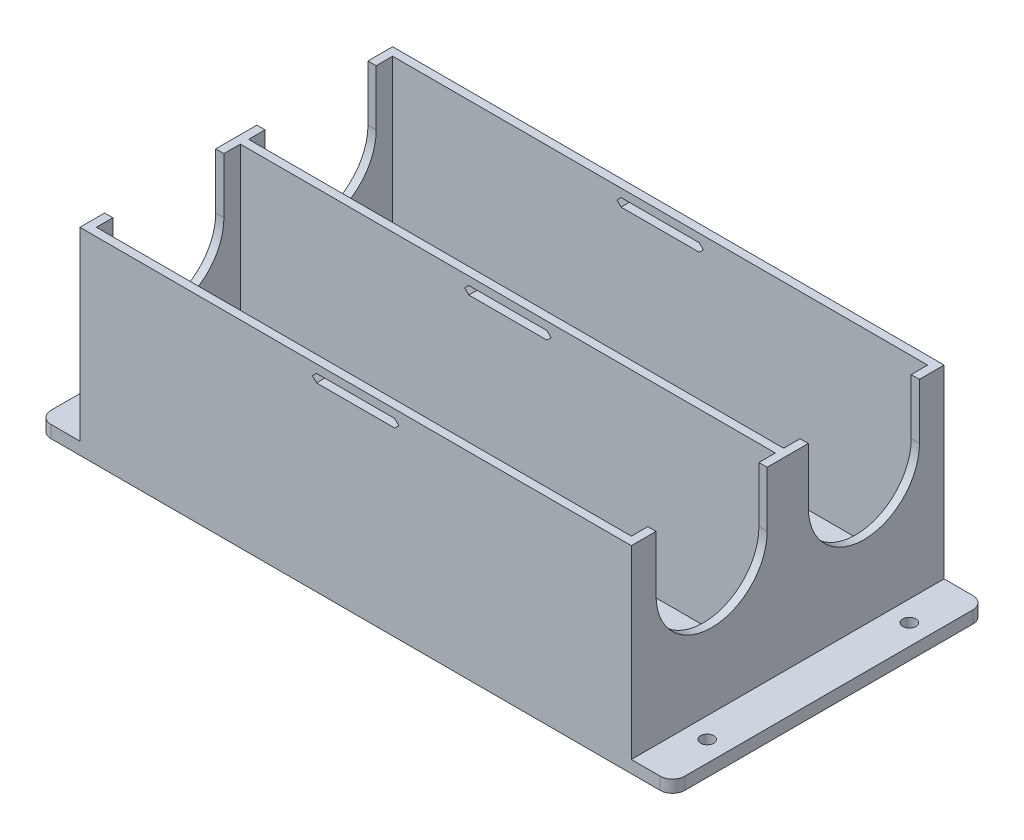
from build123d import *

# Parameters (mm, degrees)
SZKIC1_W                    = 154
SZKIC1_H                    = 76
DODANIE_WYCI_GNI_CIE1_DEPTH = 3
SZKIC1_3_W                  = 134
SZKIC1_3_H                  = 76
SZKIC1_3_W_2                = 130
SZKIC1_3_H_2                = 72
SZKIC1_3_H_3                = 2
DODANIE_WYCI_GNI_CIE2_DEPTH = 48
WYTNIJ_WYCI_GNI_CIE1_DEPTH  = 157.473639953
M3_CLEARANCE_HOLE1_D        = 3.2
M3_CLEARANCE_HOLE1_DEPTH    = 7.7
M3_CLEARANCE_HOLE1_TIP      = 0.96137699
ZAOKR_GLENIE1_R             = 3
SZKIC6_W                    = 21
SZKIC6_H                    = 2
WYTNIJ_WYCI_GNI_CIE2_DEPTH  = 119.359621493
SFAZOWANIE1_SIZE            = 1


with BuildPart() as part:
    # Szkic1 → Dodanie-wyciągnięcie1 (new body)
    with BuildSketch(Plane(origin=(0, 0, 0), x_dir=(1, 0, 0), z_dir=(0, 1, 0))):
        Rectangle(SZKIC1_W, SZKIC1_H)
    extrude(amount=DODANIE_WYCI_GNI_CIE1_DEPTH)

    # Szkic1<3> → Dodanie-wyciągnięcie2 (add)
    # profile 1 of 2: a face of its own
    with BuildSketch(Plane(origin=(0, 0, 0), x_dir=(1, 0, 0), z_dir=(0, 1, 0))):
        Rectangle(SZKIC1_3_W, SZKIC1_3_H)
        Rectangle(SZKIC1_3_W_2, SZKIC1_3_H_2, mode=Mode.SUBTRACT)
    # profile 2 of 2: a face of its own
    with BuildSketch(Plane(origin=(0, 0, 0), x_dir=(1, 0, 0), z_dir=(0, 1, 0))):
        Rectangle(SZKIC1_3_W_2, SZKIC1_3_H_3)
    extrude(amount=DODANIE_WYCI_GNI_CIE2_DEPTH)

    # Szkic2 → Wytnij-wyciągnięcie1 (cut, through all)
    with BuildSketch(Plane.ZY.offset(67)):
        with BuildLine():
            ThreePointArc((-5, 34.5), (-8.954058454, 44.045941546), (-18.5, 48))
            ThreePointArc((-18.5, 48), (-28.045941546, 44.045941546), (-32, 34.5))
            Line((-32, 34.5), (-5, 34.5))
        make_face()
        with BuildLine():
            Line((-5, 34.5), (-32, 34.5))
            ThreePointArc((-32, 34.5), (-18.5, 21), (-5, 34.5))
        make_face()
        with BuildLine():
            Line((-18.5, 48), (-32, 48))
            Line((-32, 48), (-32, 34.5))
            ThreePointArc((-32, 34.5), (-28.045941546, 44.045941546), (-18.5, 48))
        make_face()
        with BuildLine():
            Line((-5, 48), (-18.5, 48))
            ThreePointArc((-18.5, 48), (-8.954058454, 44.045941546), (-5, 34.5))
            Line((-5, 34.5), (-5, 48))
        make_face()
        with BuildLine():
            ThreePointArc((18.5, 48), (8.954058454, 44.045941546), (5, 34.5))
            Line((5, 34.5), (32, 34.5))
            ThreePointArc((32, 34.5), (28.045941546, 44.045941546), (18.5, 48))
        make_face()
        with BuildLine():
            Line((32, 34.5), (5, 34.5))
            ThreePointArc((5, 34.5), (18.5, 21), (32, 34.5))
        make_face()
        with BuildLine():
            Line((18.5, 48), (5, 48))
            Line((5, 48), (5, 34.5))
            ThreePointArc((5, 34.5), (8.954058454, 44.045941546), (18.5, 48))
        make_face()
        with BuildLine():
            Line((32, 48), (18.5, 48))
            ThreePointArc((18.5, 48), (28.045941546, 44.045941546), (32, 34.5))
            Line((32, 34.5), (32, 48))
        make_face()
    extrude(amount=-WYTNIJ_WYCI_GNI_CIE1_DEPTH, mode=Mode.SUBTRACT)

    # M3 Clearance Hole1
    with Locations(Plane(origin=(0, 3, 0), x_dir=(1, 0, 0), z_dir=(0, 1, 0))):
        with Locations((-72, 24.565309611), (-72, -24.565309611), (72, -24.565309611), (72, 24.565309611)):
            Hole(M3_CLEARANCE_HOLE1_D / 2, depth=M3_CLEARANCE_HOLE1_DEPTH)
            with Locations((0, 0, -(M3_CLEARANCE_HOLE1_DEPTH + M3_CLEARANCE_HOLE1_TIP / 2))):  # 118° drill point
                Cone(0, M3_CLEARANCE_HOLE1_D / 2, M3_CLEARANCE_HOLE1_TIP, mode=Mode.SUBTRACT)

    # Zaokrąglenie1
    zaokr_glenie1_edges = [part.edges().sort_by_distance(p)[0] for p in [
        (77, 1.5, 38),
        (77, 1.5, -38),
        (-77, 1.5, 38),
        (-77, 1.5, -38),
    ]]
    fillet(zaokr_glenie1_edges, radius=ZAOKR_GLENIE1_R)

    # Szkic6 → Wytnij-wyciągnięcie2 (cut, through all)
    with BuildSketch(Plane.XY.offset(38)):
        with Locations((0, 45)):
            Rectangle(SZKIC6_W, SZKIC6_H)
    extrude(amount=-WYTNIJ_WYCI_GNI_CIE2_DEPTH, mode=Mode.SUBTRACT)

    # Sfazowanie1
    sfazowanie1_edges = [part.edges().sort_by_distance(p)[0] for p in [
        (10.5, 44, 37),
        (10.5, 46, 37),
        (-10.5, 46, 37),
        (-10.5, 44, 37),
        (10.5, 46, -37),
        (10.5, 44, -37),
        (-10.5, 46, -37),
        (-10.5, 44, -37),
        (-10.5, 46, 0),
        (-10.5, 44, 0),
        (10.5, 46, 0),
        (10.5, 44, 0),
    ]]
    chamfer(sfazowanie1_edges, length=SFAZOWANIE1_SIZE - 0.0001)  # a hair under: the kernel refuses the full size


solid = part.part
